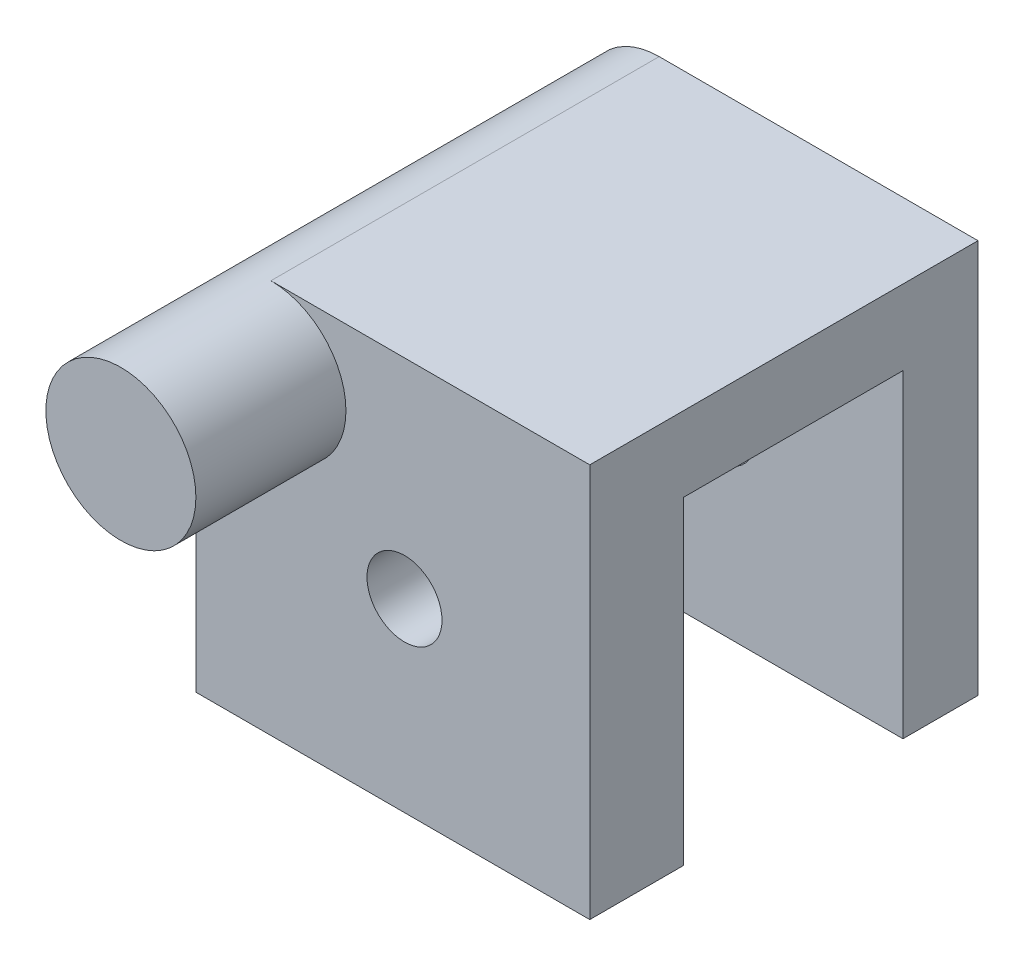
from build123d import *
from build123d.topology import SkipClean

# Parameters (mm, degrees)
BOSS_EXTRUDE1_DEPTH     = 11.7
BOSS_EXTRUDE4_START     = 8
SKETCH1_6_R             = 4
BOSS_EXTRUDE4_DEPTH     = 8
BOSS_EXTRUDE5_START     = -11.7
SKETCH1_7_R             = 2
BOSS_EXTRUDE5_DEPTH     = 4
BOSS_EXTRUDE6_START     = 5
SKETCH1_8_R             = 2
BOSS_EXTRUDE6_DEPTH     = 5
BOSS_EXTRUDE7_START     = 8
BOSS_EXTRUDE7_OUTLINE_R = 4
BOSS_EXTRUDE7_DEPTH     = 5
SKETCH2_W               = 7
SKETCH2_H               = 10
SKETCH2_H_2             = 7
SKETCH2_W_2             = 10
BOSS_EXTRUDE8_DEPTH     = 5
BOSS_EXTRUDE9_START     = -20.7
SKETCH2_3_W             = 7
SKETCH2_3_H             = 10
SKETCH2_3_W_2           = 10
SKETCH2_3_H_2           = 7
BOSS_EXTRUDE9_DEPTH     = 4


# Read off the part's stored shape, not the designer's step: Boss-Extrude7
with BuildPart() as part:
    # Sketch1 → Boss-Extrude1 (new body)
    with BuildSketch(Plane.XY):
        with BuildLine():
            Line((-36, -4), (-29, -4))
            Line((-29, -4), (-29, 0))
            Line((-29, 0), (-46, 0))
            ThreePointArc((-46, 0), (-43.171572875, -1.171572875), (-42, -4))
            Line((-42, -4), (-36, -4))
        make_face()
        with BuildLine():
            ThreePointArc((-46, -8), (-43.171572875, -6.828427125), (-42, -4))
            Line((-42, -4), (-46, -4))
            Line((-46, -4), (-46, -8))
        make_face()
        with BuildLine():
            Line((-46, -4), (-42, -4))
            ThreePointArc((-42, -4), (-43.171572875, -1.171572875), (-46, 0))
            Line((-46, 0), (-46, -4))
        make_face()
        with BuildLine():
            Line((-46, -4), (-46, 0))
            ThreePointArc((-46, 0), (-48.828427125, -1.171572875), (-50, -4))
            Line((-50, -4), (-46, -4))
        make_face()
        with BuildLine():
            Line((-46, -8), (-46, -4))
            Line((-46, -4), (-50, -4))
            ThreePointArc((-50, -4), (-48.828427125, -6.828427125), (-46, -8))
        make_face()
        with BuildLine():
            Line((-46, -14), (-46, -8))
            ThreePointArc((-46, -8), (-48.828427125, -6.828427125), (-50, -4))
            Line((-50, -4), (-50, -21))
            Line((-50, -21), (-46, -21))
            Line((-46, -21), (-46, -14))
        make_face()
    extrude(amount=-BOSS_EXTRUDE1_DEPTH)

    # Sketch1<6> → Boss-Extrude4 (add)
    with BuildSketch(Plane.XY.offset(BOSS_EXTRUDE4_START)):
        with Locations((-46, -4)):
            Circle(SKETCH1_6_R)
    extrude(amount=-BOSS_EXTRUDE4_DEPTH)

    # Sketch1<7> → Boss-Extrude5 (add)
    with SkipClean():  # the faces are left unmerged after this step: merging them gives an invalid solid
        with BuildSketch(Plane.XY.offset(BOSS_EXTRUDE5_START)):
            with BuildLine():
                Line((-36, -4), (-29, -4))
                Line((-29, -4), (-29, 0))
                Line((-29, 0), (-46, 0))
                ThreePointArc((-46, 0), (-48.828427125, -1.171572875), (-50, -4))
                Line((-50, -4), (-50, -21))
                Line((-50, -21), (-46, -21))
                Line((-46, -21), (-46, -14))
                Line((-46, -14), (-36, -14))
                Line((-36, -14), (-36, -4))
            make_face()
            with Locations((-38.878679656, -11.121320344)):
                Circle(SKETCH1_7_R, mode=Mode.SUBTRACT)
        extrude(amount=-BOSS_EXTRUDE5_DEPTH)

    # Sketch1<8> → Boss-Extrude6 (add)
    # profile 1 of 3: a face of its own
    with BuildSketch(Plane.XY.offset(BOSS_EXTRUDE6_START)):
        with BuildLine():
            Line((-46, -14), (-46, -8))
            ThreePointArc((-46, -8), (-48.828427125, -6.828427125), (-50, -4))
            Line((-50, -4), (-50, -21))
            Line((-50, -21), (-46, -21))
            Line((-46, -21), (-46, -14))
        make_face()
    # profile 2 of 3: a face of its own
    with BuildSketch(Plane.XY.offset(BOSS_EXTRUDE6_START)):
        with BuildLine():
            Line((-36, -14), (-36, -4))
            Line((-36, -4), (-42, -4))
            ThreePointArc((-42, -4), (-43.171572875, -6.828427125), (-46, -8))
            Line((-46, -8), (-46, -14))
            Line((-46, -14), (-36, -14))
        make_face()
        with Locations((-38.878679656, -11.121320344)):
            Circle(SKETCH1_8_R, mode=Mode.SUBTRACT)
    # profile 3 of 3: a face of its own
    with BuildSketch(Plane.XY.offset(BOSS_EXTRUDE6_START)):
        with BuildLine():
            Line((-36, -4), (-29, -4))
            Line((-29, -4), (-29, 0))
            Line((-29, 0), (-46, 0))
            ThreePointArc((-46, 0), (-43.171572875, -1.171572875), (-42, -4))
            Line((-42, -4), (-36, -4))
        make_face()
    extrude(amount=-BOSS_EXTRUDE6_DEPTH)

    # Boss-Extrude7 outline → Boss-Extrude7 (add)
    with BuildSketch(Plane.XY.offset(BOSS_EXTRUDE7_START)):
        with Locations((-46, -4)):
            Circle(BOSS_EXTRUDE7_OUTLINE_R)
    extrude(amount=BOSS_EXTRUDE7_DEPTH)

    # Sketch2 → Boss-Extrude8 (add)
    with BuildSketch(Plane.XY.offset(5)):
        with Locations((-32.5, -9)):
            Rectangle(SKETCH2_W, SKETCH2_H)
        with Locations((-32.5, -17.5)):
            Rectangle(SKETCH2_W, SKETCH2_H_2)
        with Locations((-41, -17.5)):
            Rectangle(SKETCH2_W_2, SKETCH2_H_2)
    extrude(amount=-BOSS_EXTRUDE8_DEPTH)

    # Sketch2<3> → Boss-Extrude9 (add)
    with BuildSketch(Plane.XY.offset(5).offset(BOSS_EXTRUDE9_START)):
        with Locations((-32.5, -9)):
            Rectangle(SKETCH2_3_W, SKETCH2_3_H)
        with Locations((-41, -17.5)):
            Rectangle(SKETCH2_3_W_2, SKETCH2_3_H_2)
        with Locations((-32.5, -17.5)):
            Rectangle(SKETCH2_3_W, SKETCH2_3_H_2)
    extrude(amount=BOSS_EXTRUDE9_DEPTH)


solid = part.part
